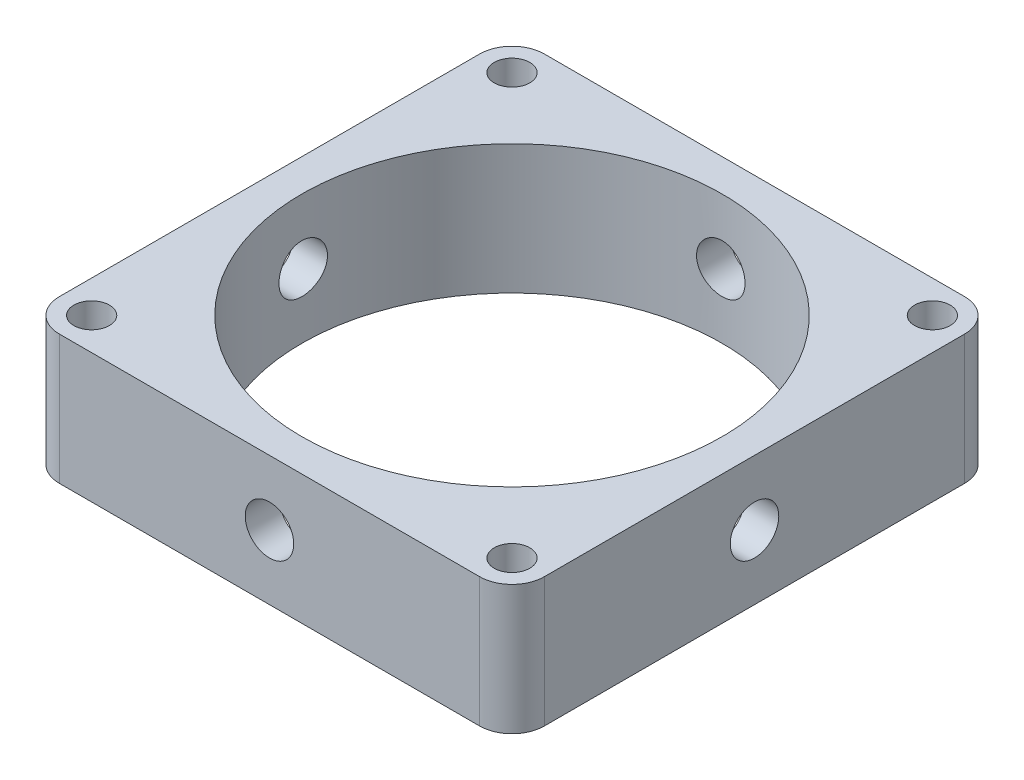
from build123d import *

# Parameters (mm, degrees)
SKETCH1_W           = 76.2
SKETCH1_H           = 76.2
SKETCH1_R           = 2.794
SKETCH1_R_2         = 33.02
BOSS_EXTRUDE1_DEPTH = 20.32
FILLET1_R           = 5.08
SKETCH2_R           = 3.81
CUT_EXTRUDE1_DEPTH  = 88.58397342
SKETCH3_R           = 3.81
CUT_EXTRUDE2_DEPTH  = 88.583973487


with BuildPart() as part:
    # Sketch1 → Boss-Extrude1 (new body)
    with BuildSketch(Plane(origin=(0, 0, 0), x_dir=(1, 0, 0), z_dir=(0, 1, 0))):
        Rectangle(SKETCH1_W, SKETCH1_H)
        with Locations((33.02, 33.02)):
            Circle(SKETCH1_R, mode=Mode.SUBTRACT)
        with Locations((33.02, -33.02)):
            Circle(SKETCH1_R, mode=Mode.SUBTRACT)
        with Locations((-33.02, -33.02)):
            Circle(SKETCH1_R, mode=Mode.SUBTRACT)
        with Locations((-33.02, 33.02)):
            Circle(SKETCH1_R, mode=Mode.SUBTRACT)
        Circle(SKETCH1_R_2, mode=Mode.SUBTRACT)
    extrude(amount=BOSS_EXTRUDE1_DEPTH)

    # Fillet1
    fillet1_edges = [part.edges().sort_by_distance(p)[0] for p in [
        (-38.1, 10.16, -38.1),
        (-38.1, 10.16, 38.1),
        (38.1, 10.16, -38.1),
        (38.1, 10.16, 38.1),
    ]]
    fillet(fillet1_edges, radius=FILLET1_R)

    # Sketch2 → Cut-Extrude1 (cut, through all)
    with BuildSketch(Plane.XY.offset(38.1)):
        with Locations((0, 10.16)):
            Circle(SKETCH2_R)
    extrude(amount=-CUT_EXTRUDE1_DEPTH, mode=Mode.SUBTRACT)

    # Sketch3 → Cut-Extrude2 (cut, through all)
    with BuildSketch(Plane(origin=(38.1, 0, 0), x_dir=(0, 0, -1), z_dir=(1, 0, 0))):
        with Locations((0, 10.16)):
            Circle(SKETCH3_R)
    extrude(amount=-CUT_EXTRUDE2_DEPTH, mode=Mode.SUBTRACT)


solid = part.part
